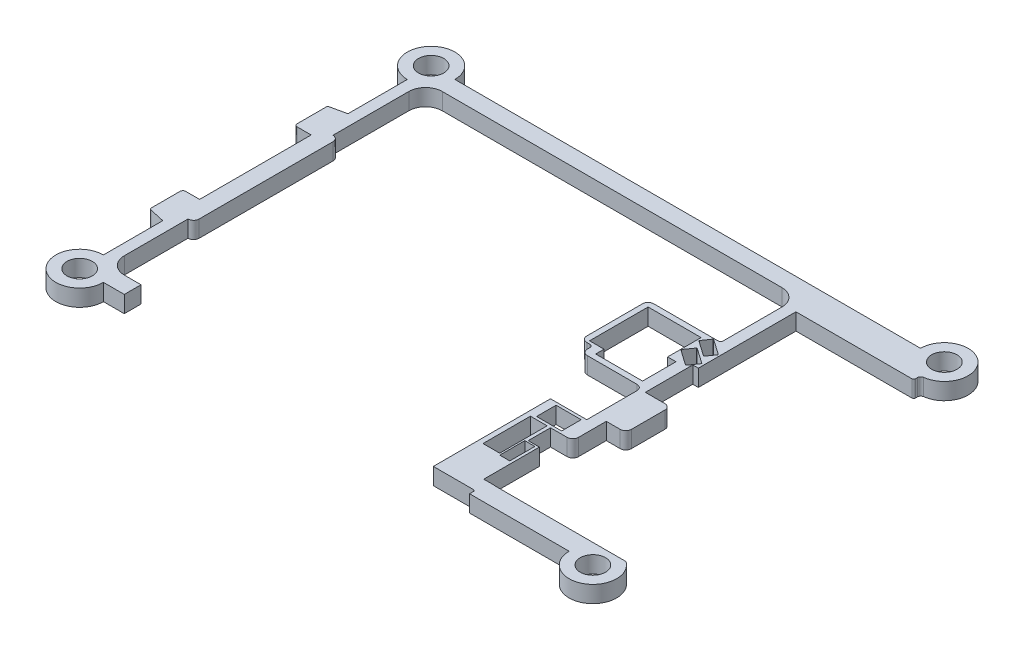
from build123d import *

# Parameters (mm, degrees)
SKETCH1_R            = 2.265
BOSS_EXTRUDE1_DEPTH  = 3
SKETCH2_W            = 6.5
SKETCH2_H            = 20
CUT_EXTRUDE1_DEPTH   = 3
BOSS_EXTRUDE2_DEPTH  = 3
CUT_EXTRUDE2_DEPTH   = 3
SKETCH5_W            = 3
SKETCH5_H            = 26
BOSS_EXTRUDE6_DEPTH  = 3
FILLET1_R            = 1
SKETCH9_W            = 57
SKETCH9_H            = 3
CUT_EXTRUDE4_DEPTH   = 3
SKETCH11_W           = 21.1
SKETCH11_H           = 54
CUT_EXTRUDE6_DEPTH   = 3
SKETCH12_W           = 5.606838984
SKETCH12_H           = 3.16637745
CUT_EXTRUDE7_DEPTH   = 3
SKETCH14_W           = 13
SKETCH14_H           = 14
SKETCH14_W_2         = 11
SKETCH14_H_2         = 12
BOSS_EXTRUDE9_DEPTH  = 3
SKETCH15_W           = 1
SKETCH15_H           = 8.5
CUT_EXTRUDE8_DEPTH   = 3
SKETCH16_W           = 3.5
SKETCH16_H           = 8
BOSS_EXTRUDE10_DEPTH = 3
SKETCH17_W           = 1.5
SKETCH17_H           = 6
BOSS_EXTRUDE11_DEPTH = 3
CUT_EXTRUDE9_DEPTH   = 3
SKETCH19_W           = 2.1
SKETCH19_H           = 2
CUT_EXTRUDE10_DEPTH  = 3
BOSS_EXTRUDE16_DEPTH = 3
FILLET2_R            = 1
FILLET3_R            = 0.5
FILLET4_R            = 0.5
FILLET6_R            = 1
SKETCH21_W           = 8
SKETCH21_H           = 22
BOSS_EXTRUDE13_DEPTH = 3
SKETCH24_W           = 4
SKETCH24_H           = 6.433647318
CUT_EXTRUDE12_DEPTH  = 3
FILLET9_R            = 1
SKETCH25_W           = 4.5
SKETCH25_H           = 3.5
SKETCH25_W_2         = 4
SKETCH25_H_2         = 4
CUT_EXTRUDE14_DEPTH  = 3
SKETCH26_W           = 4
SKETCH26_H           = 2.433647318
BOSS_EXTRUDE15_DEPTH = 3
SKETCH27_W           = 3
SKETCH27_H           = 8.5
CUT_EXTRUDE15_DEPTH  = 3
SKETCH28_W           = 1.8
SKETCH28_H           = 4.5
CUT_EXTRUDE16_DEPTH  = 3
SKETCH29_W           = 1.997350186
SKETCH29_H           = 9.968253882
CUT_EXTRUDE17_DEPTH  = 3
SKETCH30_W           = 7.5
SKETCH30_H           = 1
CUT_EXTRUDE18_DEPTH  = 3
FILLET11_R           = 0.3
FILLET12_R           = 0.6
FILLET13_R           = 0.3


with BuildPart() as part:
    # Sketch1 → Boss-Extrude1 (new body)
    with BuildSketch(Plane(origin=(0, 0, 0), x_dir=(1, 0, 0), z_dir=(0, 1, 0))):
        with BuildLine():
            Line((0, -4.265), (0, -58.735))
            ThreePointArc((0, -58.735), (-3.015810422, -66.015810422), (4.265, -63))
            Line((4.265, -63), (87.735, -63))
            ThreePointArc((87.735, -63), (95.015810422, -66.015810422), (92, -58.735))
            Line((92, -58.735), (92, -4.265))
            ThreePointArc((92, -4.265), (95.015810422, 3.015810422), (87.735, 0))
            Line((87.735, 0), (4.265, 0))
            ThreePointArc((4.265, 0), (-3.015810422, 3.015810422), (0, -4.265))
        make_face()
        with Locations(Location((0, 0, 0), (0, 0, 270))):
            Circle(SKETCH1_R, mode=Mode.SUBTRACT)
        with Locations(Location((92, 0, 0), (0, 0, 270))):
            Circle(SKETCH1_R, mode=Mode.SUBTRACT)
        with Locations(Location((92, -63, 0), (0, 0, 270))):
            Circle(SKETCH1_R, mode=Mode.SUBTRACT)
        with Locations(Location((0, -63, 0), (0, 0, 270))):
            Circle(SKETCH1_R, mode=Mode.SUBTRACT)
    extrude(amount=BOSS_EXTRUDE1_DEPTH)

    # Sketch2 → Cut-Extrude1 (cut)
    with BuildSketch(Plane(origin=(0, 3, 0), x_dir=(1, 0, 0), z_dir=(0, 1, 0))):
        with Locations((3.25, -31.5)):
            Rectangle(SKETCH2_W, SKETCH2_H)
    extrude(amount=-CUT_EXTRUDE1_DEPTH, mode=Mode.SUBTRACT)

    # Sketch3 → Boss-Extrude2 (add)
    with BuildSketch(Plane(origin=(0, 3, 0), x_dir=(1, 0, 0), z_dir=(0, 1, 0))):
        with BuildLine():
            Line((-2.7, -15.5), (0, -14.9))
            Line((0, -14.9), (0, -21.5))
            Line((0, -21.5), (-2.5, -21.5))
            ThreePointArc((-2.5, -21.5), (-2.853553391, -21.353553391), (-3, -21))
            Line((-3, -21), (-3, -15.8))
            ThreePointArc((-3, -15.8), (-2.912132034, -15.587867966), (-2.7, -15.5))
        make_face()
        with BuildLine():
            Line((-3, -42), (-3, -47.2))
            ThreePointArc((-3, -47.2), (-2.912132034, -47.412132034), (-2.7, -47.5))
            Line((-2.7, -47.5), (0, -48.1))
            Line((0, -48.1), (0, -41.5))
            Line((0, -41.5), (-2.5, -41.5))
            ThreePointArc((-2.5, -41.5), (-2.853553391, -41.646446609), (-3, -42))
        make_face()
    extrude(amount=-BOSS_EXTRUDE2_DEPTH)

    # Sketch6 → Cut-Extrude2 (cut)
    with BuildSketch(Plane(origin=(0, 3, 0), x_dir=(1, 0, 0), z_dir=(0, 1, 0))):
        with BuildLine():
            Line((5, -3), (65.9, -3))
            ThreePointArc((65.9, -3), (68.021320344, -3.878679656), (68.9, -6))
            Line((68.9, -6), (68.9, -57))
            ThreePointArc((68.9, -57), (68.021320344, -59.121320344), (65.9, -60))
            Line((65.9, -60), (5, -60))
            ThreePointArc((5, -60), (2.878679656, -59.121320344), (2, -57))
            Line((2, -57), (2, -6))
            ThreePointArc((2, -6), (2.878679656, -3.878679656), (5, -3))
        make_face()
    extrude(amount=-CUT_EXTRUDE2_DEPTH, mode=Mode.SUBTRACT)

    # Sketch5 → Boss-Extrude6 (add)
    with BuildSketch(Plane(origin=(0, 3, 0), x_dir=(1, 0, 0), z_dir=(0, 1, 0))):
        with Locations((1.5, -32.5825)):
            Rectangle(SKETCH5_W, SKETCH5_H)
    extrude(amount=-BOSS_EXTRUDE6_DEPTH)

    # Fillet1
    fillet1_edges = [part.edges().sort_by_distance(p)[0] for p in [
        (3, 1.5, 45.5825),
        (3, 1.5, 19.5825),
    ]]
    fillet(fillet1_edges, radius=FILLET1_R - 0.0001)  # a hair under: the kernel refuses the full size

    # Sketch9 → Cut-Extrude4 (cut)
    with BuildSketch(Plane(origin=(0, 3, 0), x_dir=(1, 0, 0), z_dir=(0, 1, 0))):
        with Locations((36.5, -61.5)):
            Rectangle(SKETCH9_W, SKETCH9_H)
    extrude(amount=-CUT_EXTRUDE4_DEPTH, mode=Mode.SUBTRACT)

    # Sketch11 → Cut-Extrude6 (cut)
    with BuildSketch(Plane(origin=(0, 3, 0), x_dir=(1, 0, 0), z_dir=(0, 1, 0))):
        with Locations((81.45, -32.5)):
            Rectangle(SKETCH11_W, SKETCH11_H)
    extrude(amount=-CUT_EXTRUDE6_DEPTH, mode=Mode.SUBTRACT)

    # Sketch12 → Cut-Extrude7 (cut)
    with BuildSketch(Plane(origin=(0, 3, 0), x_dir=(1, 0, 0), z_dir=(0, 1, 0))):
        with Locations((94.803419492, -57.916811275)):
            Rectangle(SKETCH12_W, SKETCH12_H)
    extrude(amount=-CUT_EXTRUDE7_DEPTH, mode=Mode.SUBTRACT)

    # Sketch14 → Boss-Extrude9 (add)
    with BuildSketch(Plane(origin=(0, 3, 0), x_dir=(1, 0, 0), z_dir=(0, 1, 0))):
        with Locations((62.4, -24)):
            Rectangle(SKETCH14_W, SKETCH14_H)
        with Locations((62.4, -24)):
            Rectangle(SKETCH14_W_2, SKETCH14_H_2, mode=Mode.SUBTRACT)
    extrude(amount=-BOSS_EXTRUDE9_DEPTH)

    # Sketch15 → Cut-Extrude8 (cut)
    with BuildSketch(Plane(origin=(0, 3, 0), x_dir=(1, 0, 0), z_dir=(0, 1, 0))):
        with Locations((70.4, -27.25)):
            Rectangle(SKETCH15_W, SKETCH15_H)
    extrude(amount=-CUT_EXTRUDE8_DEPTH, mode=Mode.SUBTRACT)

    # Sketch16 → Boss-Extrude10 (add)
    with BuildSketch(Plane(origin=(0, 3, 0), x_dir=(1, 0, 0), z_dir=(0, 1, 0))):
        with Locations((72.65, -35.5)):
            Rectangle(SKETCH16_W, SKETCH16_H)
    extrude(amount=-BOSS_EXTRUDE10_DEPTH)

    # Sketch17 → Boss-Extrude11 (add)
    with BuildSketch(Plane(origin=(0, 3, 0), x_dir=(1, 0, 0), z_dir=(0, 1, 0))):
        with Locations((67.15, -21)):
            Rectangle(SKETCH17_W, SKETCH17_H)
    extrude(amount=-BOSS_EXTRUDE11_DEPTH)

    # Sketch18 → Cut-Extrude9 (cut)
    with BuildSketch(Plane(origin=(0, 3, 0), x_dir=(1, 0, 0), z_dir=(0, 1, 0))):
        with BuildLine():
            Line((66.716936581, -18.590391311), (67.692016523, -17.197832836))
            ThreePointArc((67.692016523, -17.197832836), (67.75656691, -17.156709704), (67.831289371, -17.173275275))
            Line((67.831289371, -17.173275275), (70.534491117, -19.066077515))
            ThreePointArc((70.534491117, -19.066077515), (70.575614249, -19.130627902), (70.559048678, -19.205350363))
            Line((70.559048678, -19.205350363), (69.583968736, -20.597908838))
            ThreePointArc((69.583968736, -20.597908838), (69.51941835, -20.63903197), (69.444695888, -20.622466399))
            Line((69.444695888, -20.622466399), (66.741494142, -18.729664159))
            ThreePointArc((66.741494142, -18.729664159), (66.70037101, -18.665113772), (66.716936581, -18.590391311))
        make_face()
        with BuildLine():
            Line((66.501627394, -21.606320712), (67.591422623, -20.049931828))
            ThreePointArc((67.591422623, -20.049931828), (67.65597301, -20.008808696), (67.730695471, -20.025374267))
            Line((67.730695471, -20.025374267), (70.433897217, -21.918176507))
            ThreePointArc((70.433897217, -21.918176507), (70.475020349, -21.982726894), (70.458454778, -22.057449355))
            Line((70.458454778, -22.057449355), (69.368659549, -23.613838239))
            ThreePointArc((69.368659549, -23.613838239), (69.304109162, -23.654961371), (69.229386701, -23.6383958))
            Line((69.229386701, -23.6383958), (66.526184955, -21.74559356))
            ThreePointArc((66.526184955, -21.74559356), (66.485061823, -21.681043173), (66.501627394, -21.606320712))
        make_face()
    extrude(amount=-CUT_EXTRUDE9_DEPTH, mode=Mode.SUBTRACT)

    # Sketch19 → Cut-Extrude10 (cut)
    with BuildSketch(Plane(origin=(0, 3, 0), x_dir=(1, 0, 0), z_dir=(0, 1, 0))):
        with Locations((56.95, -30)):
            Rectangle(SKETCH19_W, SKETCH19_H)
    extrude(amount=-CUT_EXTRUDE10_DEPTH, mode=Mode.SUBTRACT)

    # Sketch31 → Boss-Extrude16 (add)
    with BuildSketch(Plane(origin=(0, 3, 0), x_dir=(1, 0, 0), z_dir=(0, 1, 0))):
        Polygon((58, -30), (59.5, -30), (59.5, -28.5), (58, -28.5), (56.9, -28.5), (56.9, -29), (58, -29), align=None)
    extrude(amount=-BOSS_EXTRUDE16_DEPTH)

    # Fillet2
    fillet2_edges = [part.edges().sort_by_distance(p)[0] for p in [
        (68.9, 1.5, 31),
        (55.9, 1.5, 17),
        (55.9, 1.5, 29),
        (58, 1.5, 31),
    ]]
    fillet(fillet2_edges, radius=FILLET2_R)

    # Fillet3
    fillet3_edges = [part.edges().sort_by_distance(p)[0] for p in [
        (68.9, 1.5, 17),
    ]]
    fillet(fillet3_edges, radius=FILLET3_R)

    # Fillet4
    fillet4_edges = [part.edges().sort_by_distance(p)[0] for p in [
        (58, 1.5, 29),
    ]]
    fillet(fillet4_edges, radius=FILLET4_R)

    # Fillet6
    fillet6_edges = [part.edges().sort_by_distance(p)[0] for p in [
        (74.4, 1.5, 31.5),
        (74.4, 1.5, 39.5),
    ]]
    fillet(fillet6_edges, radius=FILLET6_R)

    # Sketch21 → Boss-Extrude13 (add)
    with BuildSketch(Plane(origin=(0, 3, 0), x_dir=(1, 0, 0), z_dir=(0, 1, 0))):
        with Locations((66.4, -52)):
            Rectangle(SKETCH21_W, SKETCH21_H)
    extrude(amount=-BOSS_EXTRUDE13_DEPTH)

    # Sketch24 → Cut-Extrude12 (cut)
    with BuildSketch(Plane(origin=(0, 3, 0), x_dir=(1, 0, 0), z_dir=(0, 1, 0))):
        with Locations((70.14, -48.716823659)):
            Rectangle(SKETCH24_W, SKETCH24_H)
    extrude(amount=-CUT_EXTRUDE12_DEPTH, mode=Mode.SUBTRACT)

    # Fillet9
    fillet9_edges = [part.edges().sort_by_distance(p)[0] for p in [
        (70.9, 1.5, 45.5),
    ]]
    fillet(fillet9_edges, radius=FILLET9_R)

    # Sketch25 → Cut-Extrude14 (cut)
    with BuildSketch(Plane(origin=(0, 3, 0), x_dir=(1, 0, 0), z_dir=(0, 1, 0))):
        with Locations((66.15, -43.25)):
            Rectangle(SKETCH25_W, SKETCH25_H)
        with Locations((68.9, -47.5)):
            Rectangle(SKETCH25_W_2, SKETCH25_H_2)
    extrude(amount=-CUT_EXTRUDE14_DEPTH, mode=Mode.SUBTRACT)

    # Sketch26 → Boss-Extrude15 (add)
    with BuildSketch(Plane(origin=(0, 3, 0), x_dir=(1, 0, 0), z_dir=(0, 1, 0))):
        with Locations((68.9, -50.716823659)):
            Rectangle(SKETCH26_W, SKETCH26_H)
    extrude(amount=-BOSS_EXTRUDE15_DEPTH)

    # Sketch27 → Cut-Extrude15 (cut)
    with BuildSketch(Plane(origin=(0, 3, 0), x_dir=(1, 0, 0), z_dir=(0, 1, 0))):
        with Locations((64.8, -49.75)):
            Rectangle(SKETCH27_W, SKETCH27_H)
    extrude(amount=-CUT_EXTRUDE15_DEPTH, mode=Mode.SUBTRACT)

    # Sketch28 → Cut-Extrude16 (cut)
    with BuildSketch(Plane(origin=(0, 3, 0), x_dir=(1, 0, 0), z_dir=(0, 1, 0))):
        with Locations((67.5, -52.05)):
            Rectangle(SKETCH28_W, SKETCH28_H)
    extrude(amount=-CUT_EXTRUDE16_DEPTH, mode=Mode.SUBTRACT)

    # Sketch29 → Cut-Extrude17 (cut)
    with BuildSketch(Plane(origin=(0, 3, 0), x_dir=(1, 0, 0), z_dir=(0, 1, 0))):
        with Locations((69.901324907, -54.484126941)):
            Rectangle(SKETCH29_W, SKETCH29_H)
    extrude(amount=-CUT_EXTRUDE17_DEPTH, mode=Mode.SUBTRACT)

    # Sketch30 → Cut-Extrude18 (cut)
    with BuildSketch(Plane(origin=(0, 3, 0), x_dir=(1, 0, 0), z_dir=(0, 1, 0))):
        with Locations((66.15, -62.5)):
            Rectangle(SKETCH30_W, SKETCH30_H)
    extrude(amount=-CUT_EXTRUDE18_DEPTH, mode=Mode.SUBTRACT)

    # Fillet11
    fillet11_edges = [part.edges().sort_by_distance(p)[0] for p in [
        (69.9, 1.5, 62),
    ]]
    fillet(fillet11_edges, radius=FILLET11_R)

    # Fillet12
    fillet12_edges = [part.edges().sort_by_distance(p)[0] for p in [
        (92, 1.5, 4.265),
    ]]
    fillet(fillet12_edges, radius=FILLET12_R)

    # Fillet13
    fillet13_edges = [part.edges().sort_by_distance(p)[0] for p in [
        (92, 1.5, 5.5),
    ]]
    fillet(fillet13_edges, radius=FILLET13_R)


solid = part.part
